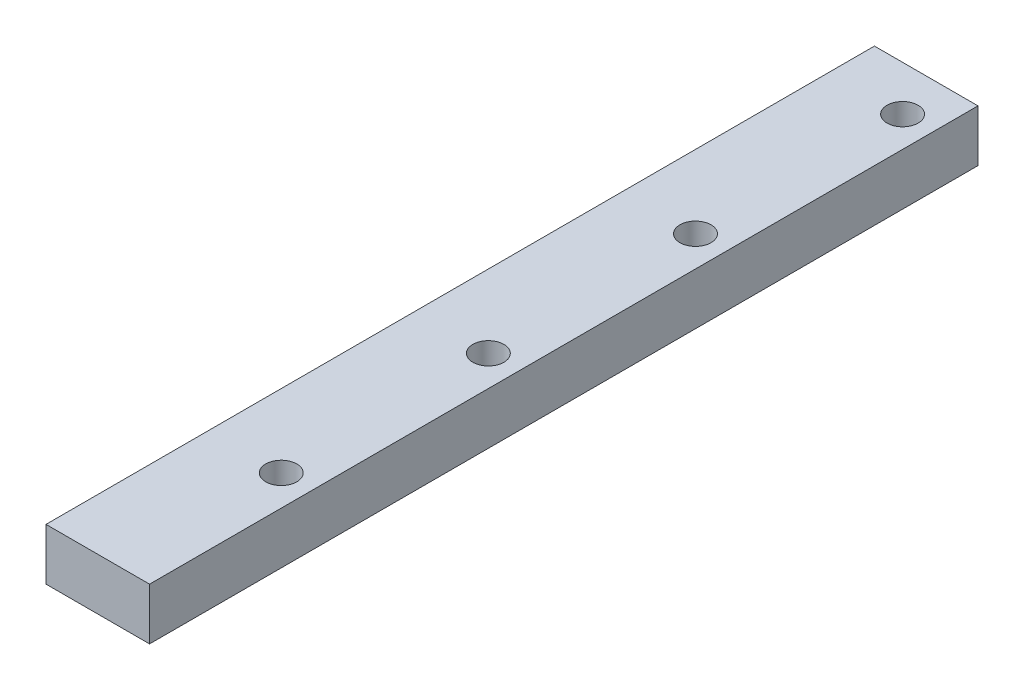
from build123d import *

# Parameters (mm, degrees)
SKETCH1_W           = 20
SKETCH1_H           = 10
BOSS_EXTRUDE1_DEPTH = 160
SKETCH2_R           = 3
CUT_EXTRUDE1_DEPTH  = 140
LPATTERN1_COUNT     = 4
LPATTERN1_PITCH     = 40


with BuildPart() as part:
    # Sketch1 → Boss-Extrude1 (new body)
    with BuildSketch(Plane.XY):
        with Locations((10, 15.187969925)):
            Rectangle(SKETCH1_W, SKETCH1_H)
    extrude(amount=BOSS_EXTRUDE1_DEPTH)

    # Sketch2 → Cut-Extrude1 (cut)
    with BuildSketch(Plane(origin=(0, 20.187969925, 0), x_dir=(1, 0, 0), z_dir=(0, 1, 0))):
        with Locations((14.108562183, -8.673667423)):
            Circle(SKETCH2_R)
    cut_extrude1 = extrude(amount=-CUT_EXTRUDE1_DEPTH, mode=Mode.SUBTRACT)

    # LPattern1: Cut-Extrude1 ×4
    with Locations(*[(0, 0, i * LPATTERN1_PITCH) for i in range(1, LPATTERN1_COUNT)]):
        add(cut_extrude1, mode=Mode.SUBTRACT)


solid = part.part
